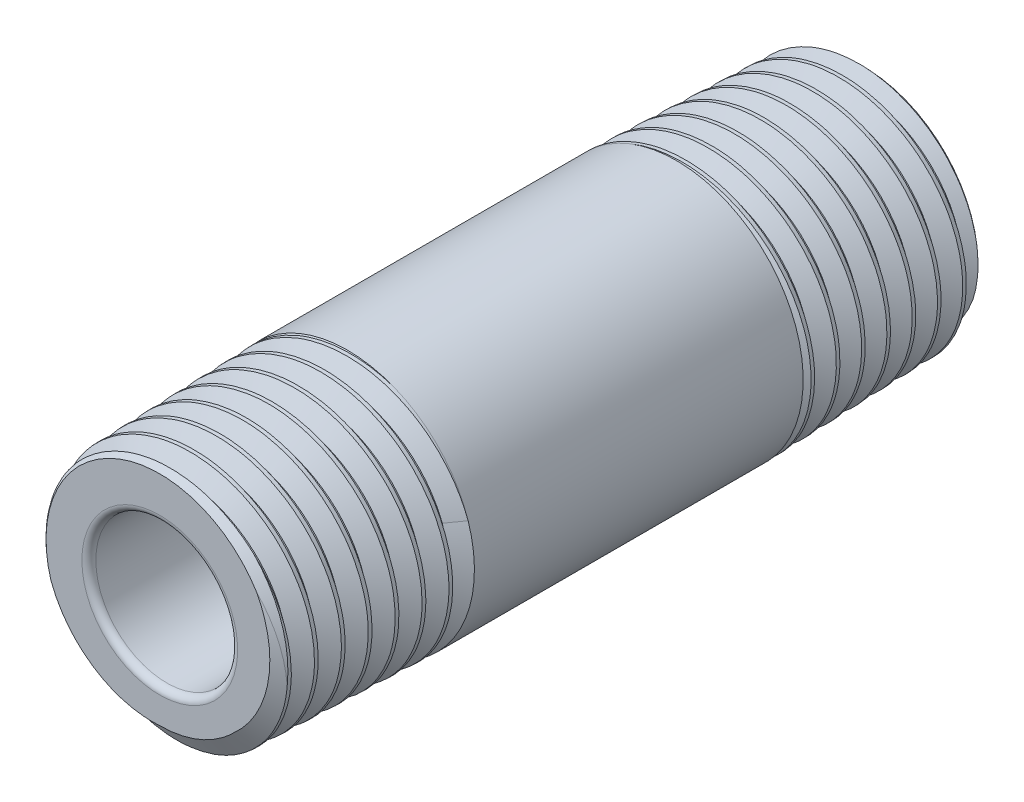
from build123d import *

# Parameters (mm, degrees)
CHAMFER1_SIZE       = 0.377825
CHAMFER1_SIZE2      = 0.390155618
FILLET1_R           = 0.377825
SKETCH6_R           = 6.858
BOSS_EXTRUDE1_DEPTH = 10.16
BOSS_EXTRUDE1_TAPER = 60
SKETCH7_R           = 3.8354
CUT_EXTRUDE1_DEPTH  = 22.376782605
CIRPATTERN1_COUNT   = 2


with BuildPart() as part:
    # Sketch2 → Revolve1 (revolve)
    with BuildSketch(Plane(origin=(0, 0, 0), x_dir=(0, 0, -1), z_dir=(1, 0, 0)), mode=Mode.PRIVATE) as revolve1_sk:
        Polygon((-19.05, 6.541667453), (-8.89, 6.858), (0, 6.858), (0, 3.8354), (-19.05, 3.8354), align=None)
    revolve(revolve1_sk.sketch.rotate(Axis((0, 0, 19.05), (0, 0, -1)), 90), axis=Axis((0, 0, 19.05), (0, 0, -1)))

    # Chamfer1
    chamfer1_edges = [part.edges().sort_by_distance(p)[0] for p in [
        (-6.541667453, 0, 19.05),
    ]]
    chamfer1_side = [part.faces().sort_by_distance(p)[0] for p in [
        (-6.699833727, 0, 13.97),
    ]]
    chamfer(chamfer1_edges, length=CHAMFER1_SIZE, length2=CHAMFER1_SIZE2, reference=chamfer1_side[0])

    # Fillet1
    fillet1_edges = [part.edges().sort_by_distance(p)[0] for p in [
        (-3.8354, 0, 19.05),
    ]]
    fillet(fillet1_edges, radius=FILLET1_R)

    # Mirror1: part across plane


with BuildPart() as part_1:
    add(part.part)
    add(part.part.mirror(Plane.XY))

    # SurfaceCut1
    split(bisect_by=Plane.XY, keep=Keep.TOP)


with BuildPart() as body_2:
    # Split1: the piece on the far side of the plane
    add(part_1.part)
    split(bisect_by=Plane.XY.offset(8.89), keep=Keep.BOTTOM)


with BuildPart() as part_2:
    add(part_1.part)

    # Split1
    split(bisect_by=Plane.XY.offset(8.89), keep=Keep.TOP)

    # Cut-Sweep1: sweep along a curve in space
    with BuildLine() as cut_sweep1_path:
        add(Edge.make_bspline(
            [(0, 6.541667453, 19.05), (0.877709824, 6.54260565, 19.019866898), (1.755426188, 6.36454889, 18.989733796), (3.371979301, 5.678320114, 18.929467593), (4.110112963, 5.170443033, 18.899334491), (5.329171692, 3.905254079, 18.839068287), (5.809565174, 3.148489228, 18.808935185), (6.435843944, 1.506162618, 18.748668981), (6.581454305, 0.621312709, 18.71853588), (6.514293191, -1.13584603, 18.658269676), (6.301547631, -2.007391876, 18.628136574), (5.551090642, -3.598488528, 18.56787037), (5.013702082, -4.317347184, 18.537737269), (3.699370211, -5.487801762, 18.477471065), (2.922995349, -5.938887116, 18.447337963), (1.254483374, -6.501167347, 18.387071759), (0.363069598, -6.612115039, 18.356938657), (-1.393109508, -6.475782942, 18.296672454), (-2.257112152, -6.228559105, 18.266539352), (-3.820197564, -5.414816609, 18.206273148), (-4.518600229, -4.848648353, 18.176140046), (-5.63846858, -3.487042596, 18.115873843), (-6.059445575, -2.692194167, 18.085740741), (-6.556635396, -0.999994035, 18.025474537), (-6.632629256, -0.103376076, 17.995341435), (-6.427099903, 1.649096883, 17.935075231), (-6.145662696, 2.504190681, 17.90494213), (-5.269679132, 4.036744925, 17.844675926), (-4.67551026, 4.713538412, 17.814542824), (-3.268579627, 5.780910407, 17.75427662), (-2.456426715, 6.171022937, 17.724143519), (-0.743081048, 6.602128049, 17.663877315), (0.15736866, 6.642930322, 17.633744213), (1.903405405, 6.368285053, 17.573478009), (2.748233908, 6.05295354, 17.543344907), (4.24777596, 5.115873787, 17.483078704), (4.901836774, 4.494529623, 17.452945602), (5.914877466, 3.044300325, 17.392679398), (6.273414878, 2.21604294, 17.362546296), (6.637540441, 0.484135954, 17.302280093), (6.642967332, -0.418762418, 17.272146991), (6.299395332, -2.155633579, 17.211880787), (5.950542417, -2.988851685, 17.181747685), (4.953610351, -4.452943436, 17.121481481), (4.305961329, -5.083179628, 17.09134838), (2.814533876, -6.040132368, 17.031082176), (1.971401186, -6.366430729, 17.000949074), (0.223554795, -6.662783093, 16.94068287), (-0.680400632, -6.632705236, 16.910549769), (-2.405381798, -6.22050361, 16.850283565), (-3.225657894, -5.838555639, 16.820150463), (-4.651908099, -4.783112521, 16.759884259), (-5.25726108, -4.110072979, 16.729751157), (-6.156450528, -2.579619152, 16.669484954), (-6.449893819, -1.722867659, 16.639351852), (-6.67778211, 0.038262492, 16.579085648), (-6.612124955, 0.941876983, 16.548952546), (-6.131698625, 2.652252983, 16.488686343), (-5.717134899, 3.458271065, 16.458553241), (-4.604617611, 4.84433924, 16.398287037), (-3.90714451, 5.423785548, 16.368153935), (-2.339904207, 6.263620563, 16.307887731), (-1.470815879, 6.523641801, 16.27775463), (0.30091269, 6.682479344, 16.217488426), (1.202784035, 6.581223457, 16.187355324), (2.895853203, 6.033084895, 16.12708912), (3.686314989, 5.586437102, 16.096956019), (5.029915236, 4.418376226, 16.036689815), (5.58246825, 3.697467799, 16.006556713), (6.361444662, 2.095745767, 15.946290509), (6.587526952, 1.215626119, 15.916157407), (6.676832539, -0.563989923, 15.855891204), (6.540013822, -1.462713871, 15.825758102), (5.924782611, -3.135792311, 15.765491898), (5.446634168, -3.909419327, 15.735358796), (4.224651908, -5.208324087, 15.675092593), (3.481346242, -5.733035696, 15.644959491), (1.847508697, -6.449738943, 15.584693287), (0.957684834, -6.641416456, 15.554560185), (-0.827086282, -6.660815453, 15.494293981), (-1.721258724, -6.488525269, 15.46416088), (-3.371684567, -5.806927495, 15.403894676), (-4.127220207, -5.297912817, 15.373761574), (-5.379263938, -4.023720777, 15.31349537), (-5.875226147, -3.259094322, 15.283362269), (-6.528333789, -1.595565458, 15.223096065), (-6.685192659, -0.697384073, 15.192962963), (-6.634417948, 1.089792458, 15.132696759), (-6.426803167, 1.978011621, 15.102563657), (-5.679670645, 3.603149251, 15.042297454), (-5.140474318, 4.339360818, 15.012164352), (-3.815871127, 5.542443584, 14.951898148), (-3.031037147, 6.008790068, 14.921765046), (-1.340295547, 6.597074161, 14.861498843), (-0.435120885, 6.718753304, 14.831365741), (1.35169838, 6.597646062, 14.771099537), (2.232567026, 6.354909017, 14.740966435), (3.829811285, 5.543178344, 14.680700231), (4.545491993, 4.974534231, 14.65056713), (5.697582959, 3.601403025, 14.590300926), (6.133490558, 2.797509982, 14.560167824), (6.655819886, 1.082084927, 14.49990162), (6.742011744, 0.171296711, 14.469768519), (6.550522053, -1.612393852, 14.409502315), (6.272920411, -2.484521474, 14.379369213), (5.397631855, -4.051301832, 14.319103009), (4.800322108, -4.745272777, 14.288969907), (3.380627875, -5.844413619, 14.228703704), (2.558857751, -6.249103764, 14.198570602), (0.821325443, -6.704445931, 14.138304398), (-0.093683227, -6.754897128, 14.108171296), (-1.871469198, -6.493084415, 14.047905093), (-2.733474212, -6.180930959, 14.017771991), (-4.267258899, -5.243227181, 13.957505787), (-4.938370996, -4.618081188, 13.927372685), (-5.982679194, -3.153867968, 13.867106481), (-6.355419274, -2.315434535, 13.83697338), (-6.742842643, -0.558414226, 13.776707176), (-6.757354565, 0.35941055, 13.746574074), (-6.425387878, 2.128515906, 13.68630787), (-6.0790502, 2.979027841, 13.656174769), (-5.080174809, 4.477327926, 13.595908565), (-4.428068052, 5.124463798, 13.565775463), (-2.921456015, 6.112135833, 13.505509259), (-2.067603042, 6.452240491, 13.475376157), (-0.293753093, 6.770915978, 13.415109954), (0.625474352, 6.749345262, 13.384976852), (2.383127268, 6.347503366, 13.324710648), (3.220788941, 5.96740348, 13.294577546), (4.681162363, 4.908699432, 13.234311343), (5.303238195, 4.230552272, 13.204178241), (6.232552626, 2.683734657, 13.143912037), (6.539384986, 1.815734071, 13.113778935), (6.788587694, 0.027747927, 13.053512731), (6.730846637, -0.891461835, 13.02337963), (6.259517949, -2.634899027, 12.963113426), (5.846131809, -3.458368707, 12.932980324), (4.729039636, -4.878424244, 12.87271412), (4.025816031, -5.474391586, 12.842581019), (2.441055964, -6.343712008, 12.782314815), (1.560205954, -6.616684832, 12.752181713), (-0.239191941, -6.795795529, 12.691915509), (-1.156958949, -6.701852412, 12.661782407), (-2.883430018, -6.161534754, 12.601516204), (-3.691383572, -5.715391691, 12.571383102), (-5.068784741, -4.541447578, 12.511116898), (-5.637632261, -3.814153717, 12.480983796), (-6.445410146, -2.193780911, 12.420717593), (-6.683986916, -1.301403992, 12.390584491), (-6.79249335, 0.506654363, 12.330318287), (-6.662372668, 1.421551037, 12.300185185), (-6.053672855, 3.128322804, 12.239918981), (-5.57535493, 3.919455822, 12.20978588), (-4.346188632, 5.25192471, 12.149519676), (-3.595871507, 5.792679897, 12.119386574), (-1.942278846, 6.537457302, 12.05912037), (-1.039719873, 6.74115322, 12.028987269), (0.774225013, 6.778651278, 11.968721065), (1.684823482, 6.612433893, 11.938587963), (3.369184312, 5.936067146, 11.878321759), (4.142214209, 5.426208412, 11.848188657), (5.427535223, 4.14354102, 11.787922454), (5.939266033, 3.371286925, 11.757789352), (6.619678173, 1.686926936, 11.697523148), (6.788061097, 0.775551078, 11.667390046), (6.754255787, -1.041488025, 11.607123843), (6.552078985, -1.946362356, 11.576990741), (5.808868172, -3.605626463, 11.516724537), (5.268153858, -4.359294555, 11.486591435), (3.933795415, -5.595318085, 11.426325231), (3.140728382, -6.07713453, 11.39619213), (1.428109601, -6.691912219, 11.335925926), (0.509300279, -6.824603505, 11.305792824), (-1.308026642, -6.719309782, 11.24552662), (-2.205755072, -6.481367245, 11.215393519), (-3.837266799, -5.672241951, 11.155127315), (-4.570340344, -5.101407562, 11.124994213), (-5.754986337, -3.717254528, 11.064728009), (-6.206042014, -2.904534693, 11.034594907), (-6.754013957, -1.166217939, 10.974328704), (-6.85068923, -0.241374724, 10.944195602), (-6.673832643, 1.573423863, 10.883929398), (-6.400374334, 2.462591036, 10.853796296), (-5.526369763, 4.063729095, 10.793530093), (-4.926200094, 4.775003303, 10.763396991), (-3.494232673, 5.90626474, 10.703130787), (-2.663054587, 6.325758293, 10.672997685), (-0.901649134, 6.805853243, 10.612731481), (0.027814386, 6.866243079, 10.58259838), (1.837263098, 6.617860253, 10.522332176), (2.71646229, 6.30919221, 10.492199074), (4.284643971, 5.371447914, 10.43193287), (4.972943979, 4.74277599, 10.401799769), (6.048890247, 3.265055312, 10.341533565), (6.436066767, 2.41664619, 10.311400463), (6.84731552, 0.63480585, 10.251134259), (6.871206049, -0.297852524, 10.221001157), (6.551444993, -2.099128822, 10.160734954), (6.207929035, -2.966964167, 10.130601852), (5.20768748, -4.499649494, 10.070335648), (4.551393413, -5.163832297, 10.040202546), (3.030058583, -6.18261245, 9.979936343), (2.165676493, -6.536764808, 9.949803241), (0.366095625, -6.878302053, 9.889537037), (-0.568322481, -6.865535475, 9.859403935), (-2.358607226, -6.474655714, 9.799137731), (-3.213695933, -6.096709059, 9.76900463), (-4.708391767, -5.035314021, 9.708738426), (-5.347348104, -4.352323791, 9.678605324), (-6.30719402, -2.789588808, 9.61833912), (-6.627664123, -1.910520807, 9.588206019), (-6.898730131, -0.095930242, 9.527939815), (-6.849205145, 0.838805009, 9.497806713), (-6.387577683, 2.615286874, 9.437540509), (-5.975672477, 3.456261422, 9.407407407), (-4.85456728, 4.91052551, 9.347141204), (-4.145851438, 5.523181708, 9.317008102), (-2.544001979, 6.422411112, 9.256741898), (-1.651562206, 6.708591095, 9.226608796), (0.175274896, 6.908533253, 9.166342593), (1.108879468, 6.8222054, 9.136209491), (2.868759351, 6.290312501, 9.075943287), (3.694269681, 5.844975265, 9.045810185), (5.105714628, 4.665700847, 8.985543981), (5.691034394, 3.932273148, 8.95541088), (6.52805377, 2.293663241, 8.895144676), (6.779387103, 1.389190947, 8.865011574), (6.90766128, -0.447101409, 8.80474537), (6.784543198, -1.378124484, 8.774612269), (6.182977999, -3.118619916, 8.714346065), (5.704788981, -3.927335589, 8.684212963), (4.468981813, -5.293632768, 8.623946759), (3.711897774, -5.850618927, 8.593813657), (2.03894634, -6.623926289, 8.533547454), (1.123803885, -6.839908819, 8.503414352), (-0.719128585, -6.896080569, 8.443148148), (-1.646118601, -6.736242158, 8.413015046), (-3.364468147, -6.065708105, 8.352748843), (-4.155080486, -5.555300548, 8.322615741), (-5.47396386, -4.264690389, 8.262349537), (-6.00166004, -3.485045778, 8.232216435), (-6.709847577, -1.780233075, 8.171950231), (-6.890028481, -0.855803872, 8.14181713), (-6.873774076, 0.990934029, 8.081550926), (-6.677342578, 1.912440949, 8.051417824), (-5.938652687, 3.605908578, 7.99115162), (-5.396712016, 4.377132781, 7.961018519), (-4.053119517, 5.646402645, 7.900752315), (-3.252048772, 6.143894902, 7.870619213), (-1.517912718, 6.78565148, 7.810353009), (-0.585599148, 6.929634143, 7.780219907), (1.26209432, 6.84074144, 7.719953704), (2.176671897, 6.607901424, 7.689820602), (3.842551341, 5.801977365, 7.629554398), (4.593128564, 5.229240287, 7.599421296), (5.810655191, 3.834574444, 7.539155093), (6.277073568, 3.013249031, 7.509021991), (6.564130329, 2.132815233, 7.478888889)],
            knots=[0, 0, 0, 0, 0.0078125, 0.0078125, 0.015625, 0.015625, 0.0234375, 0.0234375, 0.03125, 0.03125, 0.0390625, 0.0390625, 0.046875, 0.046875, 0.0546875, 0.0546875, 0.0625, 0.0625, 0.0703125, 0.0703125, 0.078125, 0.078125, 0.0859375, 0.0859375, 0.09375, 0.09375, 0.1015625, 0.1015625, 0.109375, 0.109375, 0.1171875, 0.1171875, 0.125, 0.125, 0.1328125, 0.1328125, 0.140625, 0.140625, 0.1484375, 0.1484375, 0.15625, 0.15625, 0.1640625, 0.1640625, 0.171875, 0.171875, 0.1796875, 0.1796875, 0.1875, 0.1875, 0.1953125, 0.1953125, 0.203125, 0.203125, 0.2109375, 0.2109375, 0.21875, 0.21875, 0.2265625, 0.2265625, 0.234375, 0.234375, 0.2421875, 0.2421875, 0.25, 0.25, 0.2578125, 0.2578125, 0.265625, 0.265625, 0.2734375, 0.2734375, 0.28125, 0.28125, 0.2890625, 0.2890625, 0.296875, 0.296875, 0.3046875, 0.3046875, 0.3125, 0.3125, 0.3203125, 0.3203125, 0.328125, 0.328125, 0.3359375, 0.3359375, 0.34375, 0.34375, 0.3515625, 0.3515625, 0.359375, 0.359375, 0.3671875, 0.3671875, 0.375, 0.375, 0.3828125, 0.3828125, 0.390625, 0.390625, 0.3984375, 0.3984375, 0.40625, 0.40625, 0.4140625, 0.4140625, 0.421875, 0.421875, 0.4296875, 0.4296875, 0.4375, 0.4375, 0.4453125, 0.4453125, 0.453125, 0.453125, 0.4609375, 0.4609375, 0.46875, 0.46875, 0.4765625, 0.4765625, 0.484375, 0.484375, 0.4921875, 0.4921875, 0.5, 0.5, 0.5078125, 0.5078125, 0.515625, 0.515625, 0.5234375, 0.5234375, 0.53125, 0.53125, 0.5390625, 0.5390625, 0.546875, 0.546875, 0.5546875, 0.5546875, 0.5625, 0.5625, 0.5703125, 0.5703125, 0.578125, 0.578125, 0.5859375, 0.5859375, 0.59375, 0.59375, 0.6015625, 0.6015625, 0.609375, 0.609375, 0.6171875, 0.6171875, 0.625, 0.625, 0.6328125, 0.6328125, 0.640625, 0.640625, 0.6484375, 0.6484375, 0.65625, 0.65625, 0.6640625, 0.6640625, 0.671875, 0.671875, 0.6796875, 0.6796875, 0.6875, 0.6875, 0.6953125, 0.6953125, 0.703125, 0.703125, 0.7109375, 0.7109375, 0.71875, 0.71875, 0.7265625, 0.7265625, 0.734375, 0.734375, 0.7421875, 0.7421875, 0.75, 0.75, 0.7578125, 0.7578125, 0.765625, 0.765625, 0.7734375, 0.7734375, 0.78125, 0.78125, 0.7890625, 0.7890625, 0.796875, 0.796875, 0.8046875, 0.8046875, 0.8125, 0.8125, 0.8203125, 0.8203125, 0.828125, 0.828125, 0.8359375, 0.8359375, 0.84375, 0.84375, 0.8515625, 0.8515625, 0.859375, 0.859375, 0.8671875, 0.8671875, 0.875, 0.875, 0.8828125, 0.8828125, 0.890625, 0.890625, 0.8984375, 0.8984375, 0.90625, 0.90625, 0.9140625, 0.9140625, 0.921875, 0.921875, 0.9296875, 0.9296875, 0.9375, 0.9375, 0.9453125, 0.9453125, 0.953125, 0.953125, 0.9609375, 0.9609375, 0.96875, 0.96875, 0.9765625, 0.9765625, 0.984375, 0.984375, 0.9921875, 0.9921875, 1, 1, 1, 1], degree=3))
    # Sketch4 → Cut-Sweep1 (sweep, cut)
    with BuildSketch(Plane(origin=(0, 0, 0), x_dir=(0, 0, -1), z_dir=(1, 0, 0))):
        Polygon((-19.755555556, 5.625123901), (-19.579166667, 5.625123901), (-18.961805556, 6.694424712), (-20.328819444, 6.618046082), align=None)
    sweep(path=cut_sweep1_path.line, is_frenet=True, mode=Mode.SUBTRACT)

    add(body_2.part)  # Boss-Extrude1 merges body 2
    # Sketch6 → Boss-Extrude1 (add, through all)
    with BuildSketch(Plane.XY.offset(8.89)):
        Circle(SKETCH6_R)
    extrude(amount=BOSS_EXTRUDE1_DEPTH, taper=BOSS_EXTRUDE1_TAPER)

    # Sketch7 → Cut-Extrude1 (cut, through all)
    with BuildSketch(Plane.XY):
        Circle(SKETCH7_R)
    extrude(amount=CUT_EXTRUDE1_DEPTH, mode=Mode.SUBTRACT)


with BuildPart() as cirpattern1_1:
    # CirPattern1: pattern copy
    add(part_2.part.rotate(Axis((0, 6.858, 0), (0, -1, 0)), 1 * 360 / CIRPATTERN1_COUNT))

    # Combine1: union part
    add(part_2.part)


solid = cirpattern1_1.part
